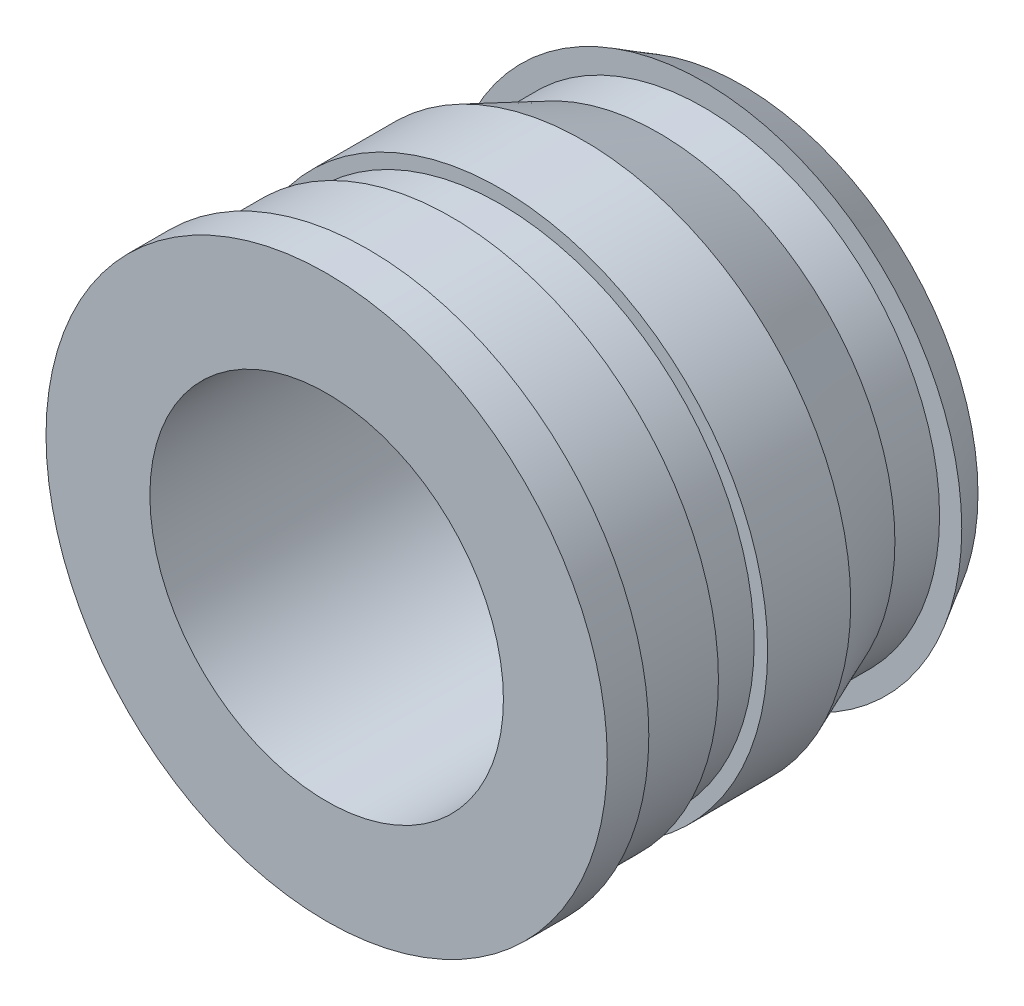
from build123d import *


with BuildPart() as part:
    # Sketch3 → Revolve1 (revolve)
    with BuildSketch(Plane(origin=(0, 0, 0), x_dir=(0, 0, -1), z_dir=(1, 0, 0))):
        Polygon((-2.35, 2), (-2.35, 3.175), (-1.88, 3.175), (-1.88, 3.0225), (-0.94, 3.0225), (-0.94, 2.87), (-0.383183073, 2.87), (-0.383183073, 3.0225), (0.556816927, 3.0225), (1.41, 2.6691), (1.915428452, 2.6691), (1.915428452, 2.92), (2.35, 2.6691), (2.35, 2), align=None)
    revolve(axis=Axis((0, 0, 2.35), (0, 0, -1)))


solid = part.part
